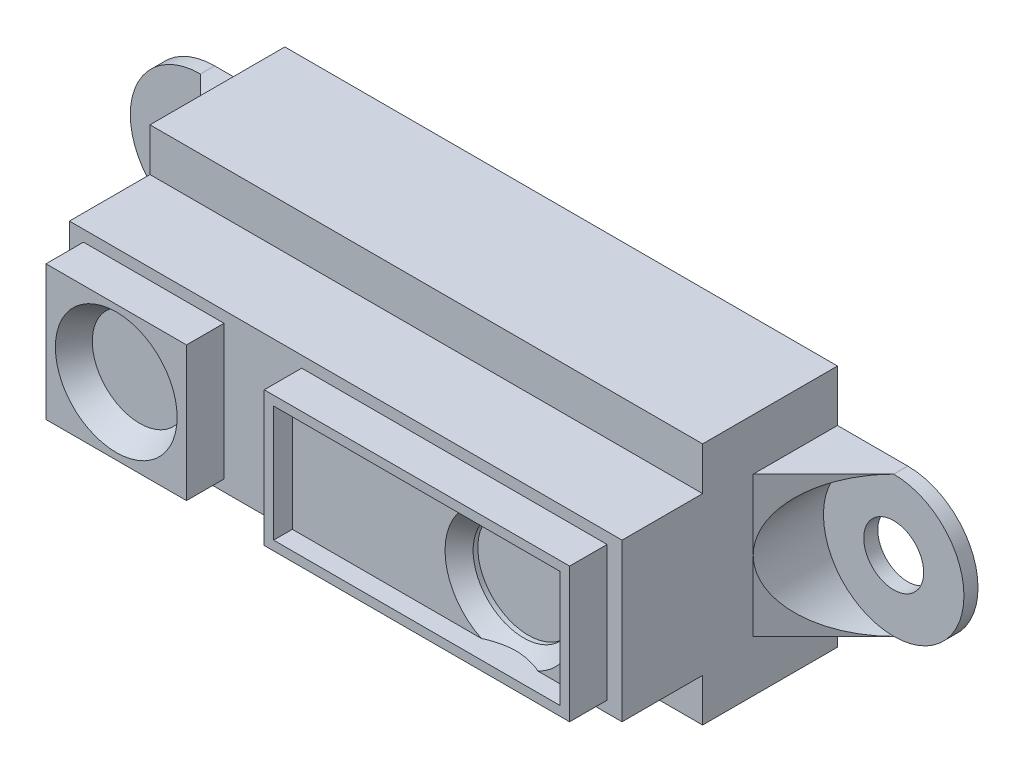
from build123d import *

# Parameters (mm, degrees)
BOSS_EXTRUDE5_DEPTH = 14.75
SKETCH9_W           = 7.5
SKETCH9_H           = 7.2
SKETCH9_W_2         = 16.3
BOSS_EXTRUDE6_DEPTH = 2
SKETCH10_W          = 15.3
SKETCH10_H          = 6.2
CUT_EXTRUDE4_DEPTH  = 1
SKETCH11_R          = 2.5
CUT_EXTRUDE5_DEPTH  = 1.25
BOSS_EXTRUDE7_DEPTH = 4.5
CUT_EXTRUDE7_START  = -7.5
CUT_EXTRUDE7_DEPTH  = 7.5
SKETCH18_R          = 3.75
CUT_EXTRUDE8_DEPTH  = 4.5
SKETCH19_R          = 1.6
CUT_EXTRUDE9_DEPTH  = 4.5
CHAMFER1_SIZE       = 0.75
CHAMFER1_SIZE_2     = 1.299038106
SKETCH13_R          = 2.7
CUT_EXTRUDE6_DEPTH  = 1
CHAMFER2_SIZE       = 0.75
SCALE1_SCALE        = 0.1


# Read off the part's stored shape, not the designer's step: Cut-Extrude7
with BuildPart() as part:
    # Sketch8 → Boss-Extrude5 (new, symmetric)
    with BuildSketch(Plane(origin=(0, 0, 0), x_dir=(0, 0, -1), z_dir=(1, 0, 0))):
        Polygon((0, -6.5), (0, 6.5), (-7.2, 6.5), (-7.2, 4.2), (-11.5, 4.2), (-11.5, -4.2), (-7.2, -4.2), (-7.2, -6.5), align=None)
    extrude(amount=BOSS_EXTRUDE5_DEPTH, both=True)

    # Sketch9 → Boss-Extrude6 (add)
    with BuildSketch(Plane.XY.offset(11.5)):
        with Locations((-10.25, 0)):
            Rectangle(SKETCH9_W, SKETCH9_H)
        with Locations((5.8, 0)):
            Rectangle(SKETCH9_W_2, SKETCH9_H)
    extrude(amount=BOSS_EXTRUDE6_DEPTH)

    # Sketch10 → Cut-Extrude4 (cut)
    with BuildSketch(Plane.XY.offset(13.5)):
        with Locations((5.8, 0)):
            Rectangle(SKETCH10_W, SKETCH10_H)
    extrude(amount=-CUT_EXTRUDE4_DEPTH, mode=Mode.SUBTRACT)

    # Sketch11 → Cut-Extrude5 (cut)
    with BuildSketch(Plane.XY.offset(13.5)):
        with Locations((-10.25, 0)):
            Circle(SKETCH11_R)
    extrude(amount=-CUT_EXTRUDE5_DEPTH, mode=Mode.SUBTRACT)

    # Sketch16 → Boss-Extrude7 (add)
    with BuildSketch(Plane(origin=(0, 0, 0), x_dir=(-1, 0, 0), z_dir=(0, 0, -1))):
        with BuildLine():
            Line((-14.75, -3.75), (-14.75, 3.75))
            Line((-14.75, 3.75), (-18.5, 3.75))
            ThreePointArc((-18.5, 3.75), (-22.25, 0), (-18.5, -3.75))
            Line((-18.5, -3.75), (-14.75, -3.75))
        make_face()
    boss_extrude7 = extrude(amount=-BOSS_EXTRUDE7_DEPTH)

    # Cut-Extrude7 outline → Cut-Extrude7 (cut)
    with BuildSketch(Plane.XZ.offset(3.75).offset(CUT_EXTRUDE7_START)):
        Polygon((14.75, 4.5), (18.5, 0.75), (24, 0.75), (24, 4.5), align=None)
    cut_extrude7 = extrude(amount=CUT_EXTRUDE7_DEPTH, mode=Mode.SUBTRACT)

    # Sketch18 → Cut-Extrude8 (cut)
    with BuildSketch(Plane.XY.offset(0.75)):
        with Locations((18.5, 0)):
            Circle(SKETCH18_R)
    cut_extrude8 = extrude(amount=CUT_EXTRUDE8_DEPTH, mode=Mode.SUBTRACT)

    # Sketch19 → Cut-Extrude9 (cut)
    with BuildSketch(Plane.XY.offset(0.75)):
        with Locations((18.5, 0)):
            Circle(SKETCH19_R)
    cut_extrude9 = extrude(amount=-CUT_EXTRUDE9_DEPTH, mode=Mode.SUBTRACT)

    # Mirror1: Boss-Extrude7, Cut-Extrude7, Cut-Extrude8, Cut-Extrude9 across plane
    add(boss_extrude7.mirror(Plane(origin=(0, 0, 0), x_dir=(0, 0, 1), z_dir=(1, 0, 0))))
    add(cut_extrude7.mirror(Plane(origin=(0, 0, 0), x_dir=(0, 0, 1), z_dir=(1, 0, 0))), mode=Mode.SUBTRACT)
    add(cut_extrude8.mirror(Plane(origin=(0, 0, 0), x_dir=(0, 0, 1), z_dir=(1, 0, 0))), mode=Mode.SUBTRACT)
    add(cut_extrude9.mirror(Plane(origin=(0, 0, 0), x_dir=(0, 0, 1), z_dir=(1, 0, 0))), mode=Mode.SUBTRACT)

    # Chamfer1
    # the kernel refuses this chamfer: 1.299038106, 0.75 mm, written as the material it takes off along each edge
    with BuildSketch(Plane(origin=(-10.25, 0, 13.5), x_dir=(1, 0, 0), z_dir=(0, -1, 0))) as chamfer1_piece_1_section:
        Polygon((2.5 + CHAMFER1_SIZE, 0), (2.5, -CHAMFER1_SIZE_2), (2.5, 0), align=None)
    chamfer1_piece_1 = revolve(axis=Axis((-10.25, 0, 13.5), (0, 0, 1)), mode=Mode.PRIVATE)
    chamfer1_piece_1 = split(chamfer1_piece_1, bisect_by=Plane(origin=(-13.133837987, 0, 12.25), z_dir=(0, 0, 1)), keep=Keep.TOP, mode=Mode.PRIVATE)
    add(chamfer1_piece_1, mode=Mode.SUBTRACT)

    # Sketch13 → Cut-Extrude6 (cut)
    with BuildSketch(Plane.XY.offset(12.5)):
        with Locations((9.75, 0)):
            Circle(SKETCH13_R)
    extrude(amount=-CUT_EXTRUDE6_DEPTH, mode=Mode.SUBTRACT)

    # Chamfer2
    # the kernel refuses this chamfer: 0.75 mm, written as the material it takes off along each edge
    with BuildSketch(Plane(origin=(9.75, 0, 12.5), x_dir=(1, 0, 0), z_dir=(0, -1, 0))) as chamfer2_piece_1_section:
        Polygon((2.7 + CHAMFER2_SIZE, 0), (2.7, -CHAMFER2_SIZE), (2.7, 0), align=None)
    chamfer2_piece_1 = revolve(axis=Axis((9.75, 0, 12.5), (0, 0, 1)), mode=Mode.PRIVATE)
    chamfer2_piece_1 = split(chamfer2_piece_1, bisect_by=Plane(origin=(6.68747717, -3.1, 12.13747717), z_dir=(0, 1, 0)), keep=Keep.TOP, mode=Mode.PRIVATE)
    chamfer2_piece_1 = split(chamfer2_piece_1, bisect_by=Plane(origin=(6.68747717, 3.1, 12.13747717), z_dir=(0, -1, 0)), keep=Keep.TOP, mode=Mode.PRIVATE)
    add(chamfer2_piece_1, mode=Mode.SUBTRACT)


with BuildPart() as part_1:
    # Scale1: scaled about (-0.05599767, 0, 5.421987795)
    add(part.part.scale(SCALE1_SCALE).moved(Location((-0.050397903, 0, 4.879789016))))


solid = part_1.part
